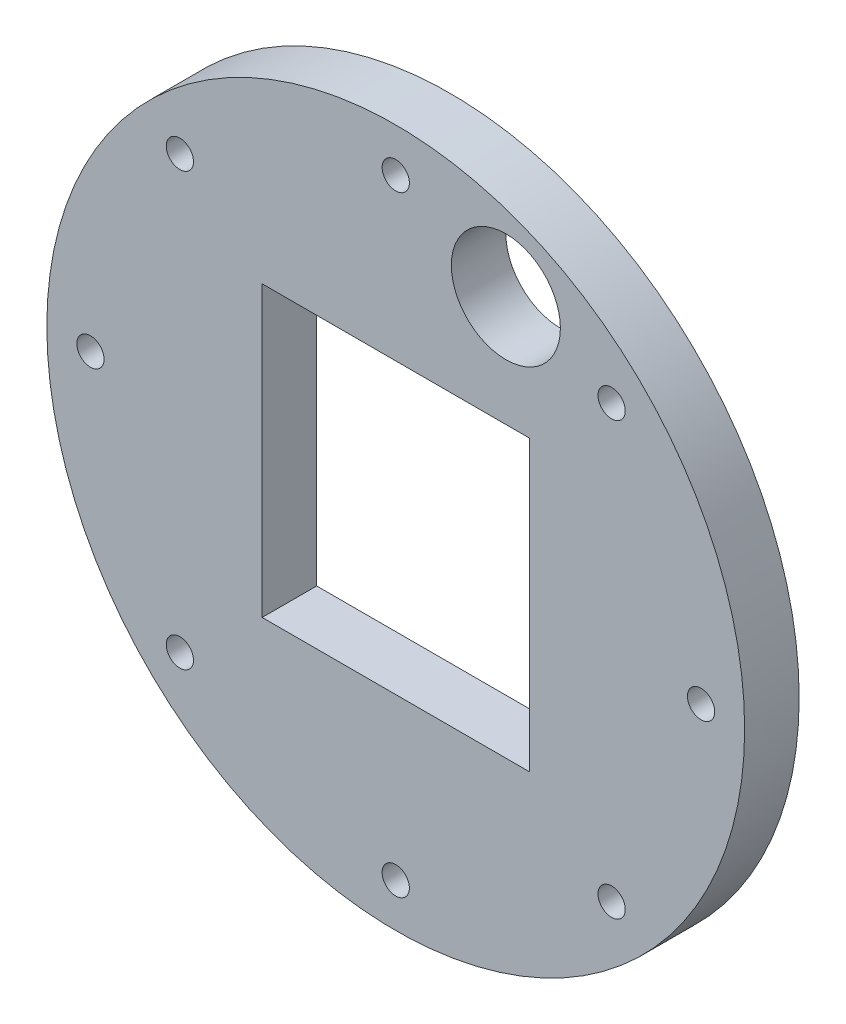
from build123d import *

# Parameters (mm, degrees)
CROQUIS1_R              = 32
SALIENTE_EXTRUIR1_DEPTH = 5
CROQUIS2_R              = 1.25
CORTAR_EXTRUIR1_DEPTH   = 46.530209751
CROQUIS3_W              = 24.5
CROQUIS3_H              = 26.5
CORTAR_EXTRUIR2_DEPTH   = 10
CROQUIS4_R              = 5
CORTAR_EXTRUIR3_DEPTH   = 10


with BuildPart() as part:
    # Croquis1 → Saliente-Extruir1 (new body)
    with BuildSketch(Plane.XY):
        Circle(CROQUIS1_R)
    extrude(amount=SALIENTE_EXTRUIR1_DEPTH)

    # Croquis2 → Cortar-Extruir1 (cut, through all)
    with BuildSketch(Plane.XY.offset(5)):
        with Locations((0, 28)):
            Circle(CROQUIS2_R)
        with Locations((19.798989873, 19.798989873)):
            Circle(CROQUIS2_R)
        with Locations((28, 0)):
            Circle(CROQUIS2_R)
        with Locations((19.798989873, -19.798989873)):
            Circle(CROQUIS2_R)
        with Locations((0, -28)):
            Circle(CROQUIS2_R)
        with Locations((-19.798989873, -19.798989873)):
            Circle(CROQUIS2_R)
        with Locations((-28, 0)):
            Circle(CROQUIS2_R)
        with Locations((-19.798989873, 19.798989873)):
            Circle(CROQUIS2_R)
    extrude(amount=-CORTAR_EXTRUIR1_DEPTH, mode=Mode.SUBTRACT)

    # Croquis3 → Cortar-Extruir2 (cut)
    with BuildSketch(Plane.XY.offset(5)):
        Rectangle(CROQUIS3_W, CROQUIS3_H)
    extrude(amount=-CORTAR_EXTRUIR2_DEPTH, mode=Mode.SUBTRACT)

    # Croquis4 → Cortar-Extruir3 (cut)
    with BuildSketch(Plane(origin=(0, 0, 0), x_dir=(-1, 0, 0), z_dir=(0, 0, -1))):
        with Locations((-10.1, 23.4)):
            Circle(CROQUIS4_R)
    extrude(amount=-CORTAR_EXTRUIR3_DEPTH, mode=Mode.SUBTRACT)


solid = part.part
